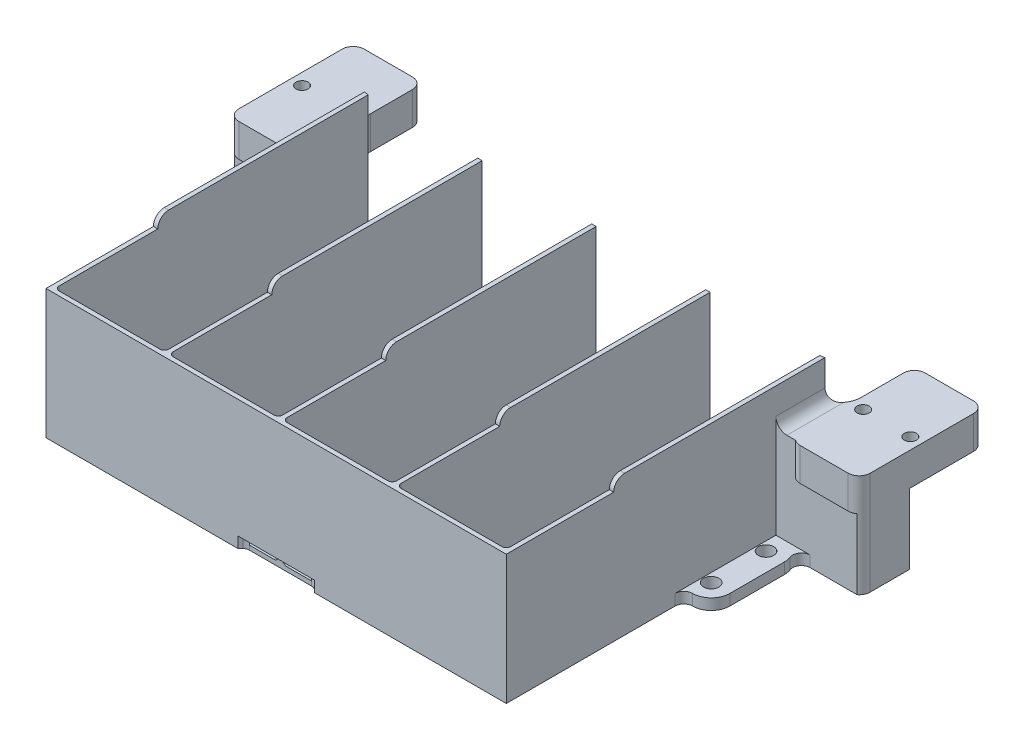
from build123d import *

# Parameters (mm, degrees)
SKETCH_2_W          = 210
SKETCH_2_H          = 67
SKETCH_2_W_2        = 50
SKETCH_2_H_2        = 63
EXTRUDE_1_DEPTH     = 143
SKETCH_3_W          = 210
SKETCH_3_H          = 67
EXTRUDE_2_DEPTH     = 2
CUT_EXTRUDE_1_DEPTH = 5
SKETCH_5_W          = 210
SKETCH_5_H          = 145
CUT_EXTRUDE_2_DEPTH = 3
SKETCH_6_R          = 3.5
EXTRUDE_3_DEPTH     = 5
SKETCH_7_W          = 39
SKETCH_7_H          = 22
EXTRUDE_4_DEPTH     = 47
SKETCH_8_R          = 2.75
EXTRUDE_5_DEPTH     = 15
CUT_EXTRUDE_3_DEPTH = 288.697758073
FILLET_1_R          = 10
FILLET_2_R          = 4
EXTRUDE_6_DEPTH     = 5
FILLET_3_R          = 5
FILLET_4_R          = 2
SKETCH_11_W         = 210
SKETCH_11_H         = 49
CUT_EXTRUDE_4_DEPTH = 5
FILLET_5_R          = 5


# Some blends are built 0.0001 mm under size
with BuildPart() as part:
    # Эскиз2 → Бобышка-Вытянуть1 (new body)
    with BuildSketch(Plane.XY):
        with Locations((100, 28.5)):
            Rectangle(SKETCH_2_W, SKETCH_2_H)
        with Locations((22, 28.5)):
            Rectangle(SKETCH_2_W_2, SKETCH_2_H_2, mode=Mode.SUBTRACT)
        with Locations((74, 28.5)):
            Rectangle(SKETCH_2_W_2, SKETCH_2_H_2, mode=Mode.SUBTRACT)
        with Locations((126, 28.5)):
            Rectangle(SKETCH_2_W_2, SKETCH_2_H_2, mode=Mode.SUBTRACT)
        with Locations((178, 28.5)):
            Rectangle(SKETCH_2_W_2, SKETCH_2_H_2, mode=Mode.SUBTRACT)
    extrude(amount=EXTRUDE_1_DEPTH)

    # Эскиз3 → Бобышка-Вытянуть2 (add)
    with BuildSketch(Plane.XY.offset(143)):
        with Locations((100, 28.5)):
            Rectangle(SKETCH_3_W, SKETCH_3_H)
    extrude(amount=EXTRUDE_2_DEPTH)

    # Эскиз4 → Вырез-Вытянуть1 (cut)
    with BuildSketch(Plane.XZ.offset(5)):
        with BuildLine():
            Line((85.828427125, 143), (114.171572875, 143))
            ThreePointArc((114.171572875, 143), (115.319623172, 143.228361402), (116.292893219, 143.878679656))
            Line((116.292893219, 143.878679656), (118.414213562, 146))
            Line((118.414213562, 146), (81.585786438, 146))
            Line((81.585786438, 146), (83.707106781, 143.878679656))
            ThreePointArc((83.707106781, 143.878679656), (84.680376828, 143.228361402), (85.828427125, 143))
        make_face()
    extrude(amount=-CUT_EXTRUDE_1_DEPTH, mode=Mode.SUBTRACT)

    # Эскиз5 → Вырез-Вытянуть2 (cut)
    with BuildSketch(Plane(origin=(0, 62, 0), x_dir=(1, 0, 0), z_dir=(0, 1, 0))):
        with Locations((100, -72.5)):
            Rectangle(SKETCH_5_W, SKETCH_5_H)
    extrude(amount=-CUT_EXTRUDE_2_DEPTH, mode=Mode.SUBTRACT)

    # Эскиз6 → Бобышка-Вытянуть3 (add)
    # profile 1 of 4: a face of its own
    with BuildSketch(Plane.XZ.offset(5)):
        with BuildLine():
            Line((205, 22), (205, 39))
            Line((205, 39), (209, 39))
            ThreePointArc((209, 39), (217.5, 30.5), (209, 22))
            Line((209, 22), (205, 22))
        make_face()
        with Locations(Location((209, 30.5, 0), (0, 0, 270))):
            Circle(SKETCH_6_R, mode=Mode.SUBTRACT)
    # profile 2 of 4: a face of its own
    with BuildSketch(Plane.XZ.offset(5)):
        with BuildLine():
            Line((209, 47), (205, 47))
            Line((205, 47), (205, 64))
            Line((205, 64), (209, 64))
            ThreePointArc((209, 64), (217.5, 55.5), (209, 47))
        make_face()
        with Locations(Location((209, 55.5, 0), (0, 0, 270))):
            Circle(SKETCH_6_R, mode=Mode.SUBTRACT)
    # profile 3 of 4: a face of its own
    with BuildSketch(Plane.XZ.offset(5)):
        with BuildLine():
            Line((-5, 47), (-5, 64))
            Line((-5, 64), (-9, 64))
            ThreePointArc((-9, 64), (-17.5, 55.5), (-9, 47))
            Line((-9, 47), (-5, 47))
        make_face()
        with Locations(Location((-9, 55.5, 0), (0, 0, 90))):
            Circle(SKETCH_6_R, mode=Mode.SUBTRACT)
    # profile 4 of 4: a face of its own
    with BuildSketch(Plane.XZ.offset(5)):
        with BuildLine():
            Line((-9, 39), (-5, 39))
            Line((-5, 39), (-5, 22))
            Line((-5, 22), (-9, 22))
            ThreePointArc((-9, 22), (-17.5, 30.5), (-9, 39))
        make_face()
        with Locations(Location((-9, 30.5, 0), (0, 0, 90))):
            Circle(SKETCH_6_R, mode=Mode.SUBTRACT)
    extrude(amount=-EXTRUDE_3_DEPTH)

    # Эскиз7 → Бобышка-Вытянуть4 (add)
    with BuildSketch(Plane.XZ.offset(5)):
        with Locations((224.5, 11)):
            Rectangle(SKETCH_7_W, SKETCH_7_H)
    extrude(amount=-EXTRUDE_4_DEPTH)

    # Эскиз8 → Бобышка-Вытянуть5 (add)
    with BuildSketch(Plane.XZ.offset(-42)):
        with BuildLine():
            Line((239, 23), (217, 23))
            ThreePointArc((217, 23), (213.464466094, 21.535533906), (212, 18))
            Line((212, 18), (212, -29.15))
            ThreePointArc((212, -29.15), (213.464466094, -32.685533906), (217, -34.15))
            Line((217, -34.15), (239, -34.15))
            ThreePointArc((239, -34.15), (242.535533906, -32.685533906), (244, -29.15))
            Line((244, -29.15), (244, 18))
            ThreePointArc((244, 18), (242.535533906, 21.535533906), (239, 23))
        make_face()
        with Locations(Location((238.75, -5.575, 0), (0, 0, 270))):
            Circle(SKETCH_8_R, mode=Mode.SUBTRACT)
        with Locations(Location((217.25, -5.575, 0), (0, 0, 270))):
            Circle(SKETCH_8_R, mode=Mode.SUBTRACT)
    extrude(amount=EXTRUDE_5_DEPTH)

    # Эскиз9 → Вырез-Вытянуть3 (cut, through all)
    with BuildSketch(Plane(origin=(0, 42, 0), x_dir=(1, 0, 0), z_dir=(0, 1, 0))):
        with BuildLine():
            Line((239, -23), (235.274216073, -23))
            Line((235.274216073, -23), (246.59675483, -31.709945179))
            Line((246.59675483, -31.709945179), (255.697113083, -21.551405734))
            Line((255.697113083, -21.551405734), (244, -13.403410553))
            Line((244, -13.403410553), (244, -18))
            ThreePointArc((244, -18), (242.535533906, -21.535533906), (239, -23))
        make_face()
    extrude(amount=-CUT_EXTRUDE_3_DEPTH, mode=Mode.SUBTRACT)

    # Скругление1
    # the kernel refuses this fillet: 10 mm, written as the material it adds along each edge
    with BuildSketch(Plane(origin=(212, 66.874685928, 0), x_dir=(0, 0, -1), z_dir=(0, -1, 0))) as fillet_1_piece_1_section:
        with BuildLine():
            CenterArc((9.949874371, -10), FILLET_1_R, 90, 84.260829523)
            Line((0, -9), (0, 0))
            Line((0, 0), (9.949874371, 0))
        make_face()
    fillet_1_piece_1 = extrude(amount=39.874685928, mode=Mode.PRIVATE)
    fillet_1_piece_1 = split(fillet_1_piece_1, bisect_by=Plane(origin=(205, 50.5, -0.134473646), z_dir=(-1, 0, 0)), keep=Keep.TOP, mode=Mode.PRIVATE)
    fillet_1_piece_1 = split(fillet_1_piece_1, bisect_by=Plane(origin=(204.014524412, 59, -0.134473646), z_dir=(0, -1, 0)), keep=Keep.TOP, mode=Mode.PRIVATE)
    add(fillet_1_piece_1)
    with BuildSketch(Plane(origin=(212, 42, 0), x_dir=(0, 0, -1), z_dir=(0, -1, 0))) as fillet_1_piece_2:
        with BuildLine():
            CenterArc((9.949874371, -10), FILLET_1_R, 90, 84.260829523)
            Line((0, -9), (0, 0))
            Line((0, 0), (9.949874371, 0))
        make_face()
    extrude(amount=15)

    # Скругление2
    fillet_2_edges = [part.edges().sort_by_distance(p)[0] for p in [
        (209, -2.5, 22),
        (205, -2.5, 64),
        (205, -2.5, 47),
        (205, -2.5, 39),
    ]]
    fillet(fillet_2_edges, radius=FILLET_2_R - 0.0001)  # a hair under: the kernel refuses the full size

    # Эскиз10 → Бобышка-Вытянуть6 (add)
    with BuildSketch(Plane(origin=(0, 0, 0), x_dir=(1, 0, 0), z_dir=(0, 1, 0))):
        Polygon((217.5, -30.5), (217.5, -55.5), (206.060928994, -47), (205, -45.939071006), (205, -34.579189919), (213.295374463, -34.579189919), align=None)
    extrude(amount=-EXTRUDE_6_DEPTH)

    # Зеркальное отражение1: part across plane


with BuildPart() as part_1:
    add(part.part)
    add(part.part.mirror(Plane(origin=(100, 0, 0), x_dir=(0, 0, 1), z_dir=(1, 0, 0))))

    # Скругление3
    fillet_3_edges = [part_1.edges().sort_by_distance(p)[0] for p in [
        (205, 42, 10.794758822),
        (-5, 42, 10.794758822),
    ]]
    fillet(fillet_3_edges, radius=FILLET_3_R)

    # Скругление4
    fillet_4_edges = [part_1.edges().sort_by_distance(p)[0] for p in [
        (203, -3, 71.5),
        (178, -3, 143),
        (153, -3, 71.5),
        (203, 28, 143),
        (153, 28, 143),
        (151, 28, 143),
        (151, -3, 71.5),
        (101, -3, 71.5),
        (101, 29.5, 143),
        (99, 29.5, 143),
        (49, 28, 143),
        (-3, 28, 143),
        (-3, -3, 71.5),
        (47, 28, 143),
        (22, -3, 143),
        (47, -3, 71.5),
        (49, -3, 71.5),
        (99, -3, 71.5),
    ]]
    fillet(fillet_4_edges, radius=FILLET_4_R)

    # Эскиз11 → Вырез-Вытянуть4 (cut)
    with BuildSketch(Plane(origin=(0, 59, 0), x_dir=(1, 0, 0), z_dir=(0, 1, 0))):
        with Locations((100, -120.5)):
            Rectangle(SKETCH_11_W, SKETCH_11_H)
    extrude(amount=-CUT_EXTRUDE_4_DEPTH, mode=Mode.SUBTRACT)

    # Скругление5
    # the kernel refuses this fillet: 5 mm, written as the material it takes off along each edge
    with BuildSketch(Plane(origin=(165.5, 59, 96), x_dir=(0, -1, 0), z_dir=(-1, 0, 0)), Plane(origin=(113.5, 59, 96), x_dir=(0, -1, 0), z_dir=(-1, 0, 0)), Plane(origin=(61.5, 59, 96), x_dir=(0, -1, 0), z_dir=(-1, 0, 0)), Plane(origin=(217.5, 59, 96), x_dir=(0, -1, 0), z_dir=(-1, 0, 0))) as fillet_5_piece_1:
        with BuildLine():
            CenterArc((FILLET_5_R, -FILLET_5_R), FILLET_5_R, 90, 90)
            Line((0, -FILLET_5_R), (0, 0))
            Line((0, 0), (FILLET_5_R, 0))
        make_face()
    extrude(amount=27, mode=Mode.SUBTRACT)
    with BuildSketch(Plane(origin=(9.5, 59, 96), x_dir=(0, 0, -1), z_dir=(-1, 0, 0))) as fillet_5_piece_2:
        with BuildLine():
            CenterArc((FILLET_5_R, FILLET_5_R), FILLET_5_R, 180, 90)
            Line((0, FILLET_5_R), (0, 0))
            Line((0, 0), (FILLET_5_R, 0))
        make_face()
    extrude(amount=27, mode=Mode.SUBTRACT)


solid = part_1.part
